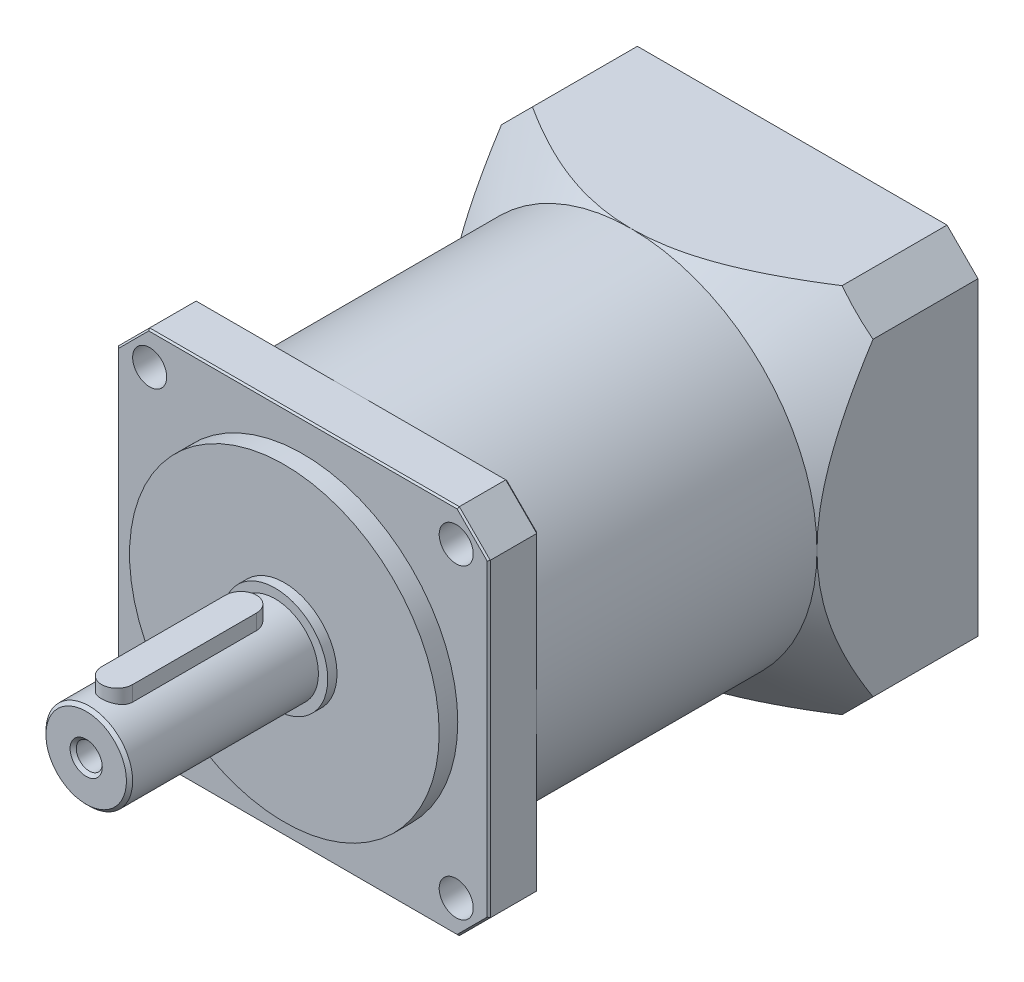
from build123d import *
from build123d.topology import SkipClean

# Parameters (mm, degrees)
SKETCH_1_W                  = 60
SKETCH_1_H                  = 60
EXTRUDE_1_DEPTH             = 32
SKETCH_2_R                  = 30
EXTRUDE_2_DEPTH             = 39
SKETCH_3_W                  = 60
SKETCH_3_H                  = 60
EXTRUDE_3_DEPTH             = 8
SKETCH_4_R                  = 25
EXTRUDE_4_DEPTH             = 3
SKETCH_5_R                  = 7
EXTRUDE_5_DEPTH             = 35
SKETCH_6_R                  = 8.5
EXTRUDE_6_DEPTH             = 4.5
CHAMFER_1_SIZE              = 5
HOLE_WIZARD_5_5_5_5_1_D     = 5.5
HOLE_WIZARD_5_5_5_5_1_DEPTH = 24
HOLE_WIZARD_5_5_5_5_1_TIP   = 1.652366702
HOLE_WIZARD_M51_D           = 4.2
HOLE_WIZARD_M51_DEPTH       = 15
HOLE_WIZARD_M51_TIP         = 1.2618073
EXTRUDE_7_DEPTH             = 9
CHAMFER_2_SIZE              = 0.5
HOLE_WIZARD_M52_D           = 4.2
HOLE_WIZARD_M52_DEPTH       = 15
HOLE_WIZARD_M52_TIP         = 1.2618073
CHAMFER_3_SIZE              = 0.5
CHAMFER_4_SIZE              = 0.25


with BuildPart() as part:
    # Эскиз1 → Бобышка-Вытянуть1 (new body)
    with BuildSketch(Plane.XY):
        Rectangle(SKETCH_1_W, SKETCH_1_H)
    extrude(amount=EXTRUDE_1_DEPTH)

    # Эскиз2 → Бобышка-Вытянуть2 (add)
    with BuildSketch(Plane.XY.offset(32)):
        Circle(SKETCH_2_R)
    extrude(amount=EXTRUDE_2_DEPTH)

    # Эскиз3 → Бобышка-Вытянуть3 (add)
    with BuildSketch(Plane.XY.offset(71)):
        Rectangle(SKETCH_3_W, SKETCH_3_H)
    extrude(amount=EXTRUDE_3_DEPTH)

    # Эскиз4 → Бобышка-Вытянуть4 (add)
    with BuildSketch(Plane.XY.offset(79)):
        Circle(SKETCH_4_R)
    extrude(amount=EXTRUDE_4_DEPTH)

    # Эскиз5 → Бобышка-Вытянуть5 (add)
    with BuildSketch(Plane.XY.offset(79)):
        Circle(SKETCH_5_R)
    extrude(amount=EXTRUDE_5_DEPTH)

    # Эскиз6 → Бобышка-Вытянуть6 (add)
    with BuildSketch(Plane.XY.offset(79)):
        Circle(SKETCH_6_R)
    extrude(amount=EXTRUDE_6_DEPTH)

    # Фаска1
    chamfer_1_edges = [part.edges().sort_by_distance(p)[0] for p in [
        (-30, 30, 75),
        (-30, -30, 75),
        (30, -30, 75),
        (30, 30, 75),
        (30, -30, 16),
        (-30, -30, 16),
        (-30, 30, 16),
        (30, 30, 16),
    ]]
    chamfer(chamfer_1_edges, length=CHAMFER_1_SIZE)

    # Диаметр отверстия Ø5.5 (5.5)1
    with Locations(Plane.XY.offset(79)):
        with Locations((-24.748737342, 24.748737342), (24.748737342, 24.748737342), (24.748737342, -24.748737342), (-24.748737342, -24.748737342)):
            Hole(HOLE_WIZARD_5_5_5_5_1_D / 2, depth=HOLE_WIZARD_5_5_5_5_1_DEPTH)
            with Locations((0, 0, -(HOLE_WIZARD_5_5_5_5_1_DEPTH + HOLE_WIZARD_5_5_5_5_1_TIP / 2))):  # 118° drill point
                Cone(0, HOLE_WIZARD_5_5_5_5_1_D / 2, HOLE_WIZARD_5_5_5_5_1_TIP, mode=Mode.SUBTRACT)

    # Отверстие обработанное метчиком M51
    with Locations(Plane(origin=(0, 0, 0), x_dir=(-1, 0, 0), z_dir=(0, 0, -1))):
        with Locations((-23.57, 23.57), (23.57, 23.57), (23.57, -23.57), (-23.57, -23.57)):
            Hole(HOLE_WIZARD_M51_D / 2, depth=HOLE_WIZARD_M51_DEPTH)
            with Locations((0, 0, -(HOLE_WIZARD_M51_DEPTH + HOLE_WIZARD_M51_TIP / 2))):  # 118° drill point
                Cone(0, HOLE_WIZARD_M51_D / 2, HOLE_WIZARD_M51_TIP, mode=Mode.SUBTRACT)

    # Эскиз13 → Вырез-Повернуть1 (revolve, cut)
    with SkipClean():  # the faces are left unmerged after this step: merging them gives an invalid solid
        with BuildSketch(Plane(origin=(0, 0, 0), x_dir=(0, 0, -1), z_dir=(1, 0, 0)), mode=Mode.PRIVATE) as cut_revolve_1_sk:
            Polygon((-32, 41), (-15, 41), (-26, 30), (-32, 30), align=None)
        revolve(cut_revolve_1_sk.sketch.rotate(Axis((0, 0, 0), (0, 0, 1)), 90), axis=Axis((0, 0, 0), (0, 0, 1)), mode=Mode.SUBTRACT)

    # Эскиз14 → Бобышка-Вытянуть7 (add)
    with SkipClean():  # the faces are left unmerged after this step: merging them gives an invalid solid
        with BuildSketch(Plane(origin=(0, 0, 0), x_dir=(1, 0, 0), z_dir=(0, 1, 0))):
            with BuildLine():
                Line((2.5, -89), (2.5, -109))
                ThreePointArc((2.5, -109), (0, -111.5), (-2.5, -109))
                Line((-2.5, -109), (-2.5, -89))
                ThreePointArc((-2.5, -89), (0, -86.5), (2.5, -89))
            make_face()
        extrude(amount=EXTRUDE_7_DEPTH)

    # Фаска2
    chamfer_2_edges = [part.edges().sort_by_distance(p)[0] for p in [
        (-7, 0, 114),
    ]]
    chamfer(chamfer_2_edges, length=CHAMFER_2_SIZE)

    # Отверстие обработанное метчиком M52
    with Locations(Plane.XY.offset(114)):
        with Locations((0, 0)):
            Hole(HOLE_WIZARD_M52_D / 2, depth=HOLE_WIZARD_M52_DEPTH)
            with Locations((0, 0, -(HOLE_WIZARD_M52_DEPTH + HOLE_WIZARD_M52_TIP / 2))):  # 118° drill point
                Cone(0, HOLE_WIZARD_M52_D / 2, HOLE_WIZARD_M52_TIP, mode=Mode.SUBTRACT)

    # Фаска3
    chamfer_3_edges = [part.edges().sort_by_distance(p)[0] for p in [
        (2.1, 0, 114),
    ]]
    chamfer(chamfer_3_edges, length=CHAMFER_3_SIZE)

    # Фаска4
    # the kernel refuses this chamfer: 0.25 mm, written as the material it takes off along each edge
    with BuildSketch(Plane(origin=(-30, -25.642920747, 71), x_dir=(-0.02749587661058229, 0, 0.9996219169112968), z_dir=(0, 1, 0))) as chamfer_4_piece_1_section:
        Polygon((CHAMFER_4_SIZE * 0.999621916911, CHAMFER_4_SIZE * 0.0274958766106), (-CHAMFER_4_SIZE * 0.0274958766106, CHAMFER_4_SIZE * 0.999621916911), (0, 0), align=None)
    chamfer_4_piece_1 = extrude(amount=25.642920747, mode=Mode.PRIVATE)
    chamfer_4_piece_1 = chamfer_4_piece_1 - Plane(origin=(0, 0, 71.084323924), x_dir=(1, 0, 0), z_dir=(0, 0, -1)) * Cylinder(30, 53, mode=Mode.PRIVATE)
    add(chamfer_4_piece_1, mode=Mode.SUBTRACT)
    with BuildSketch(Plane(origin=(25.642920747, -30, 71), x_dir=(0, -0.02749587661058229, 0.9996219169112968), z_dir=(-1, 0, 0))) as chamfer_4_piece_2_section:
        Polygon((CHAMFER_4_SIZE * 0.999621916911, CHAMFER_4_SIZE * 0.0274958766106), (-CHAMFER_4_SIZE * 0.0274958766106, CHAMFER_4_SIZE * 0.999621916911), (0, 0), align=None)
    chamfer_4_piece_2 = extrude(amount=25.642920747, mode=Mode.PRIVATE)
    chamfer_4_piece_2 = chamfer_4_piece_2 - Plane(origin=(0, 0, 71.084323924), x_dir=(1, 0, 0), z_dir=(0, 0, -1)) * Cylinder(30, 53, mode=Mode.PRIVATE)
    add(chamfer_4_piece_2, mode=Mode.SUBTRACT)
    with BuildSketch(Plane(origin=(30, 25.642920747, 71), x_dir=(0.02749587661058229, 0, 0.9996219169112968), z_dir=(0, -1, 0))) as chamfer_4_piece_3_section:
        Polygon((CHAMFER_4_SIZE * 0.999621916911, CHAMFER_4_SIZE * 0.0274958766106), (-CHAMFER_4_SIZE * 0.0274958766106, CHAMFER_4_SIZE * 0.999621916911), (0, 0), align=None)
    chamfer_4_piece_3 = extrude(amount=25.642920747, mode=Mode.PRIVATE)
    chamfer_4_piece_3 = chamfer_4_piece_3 - Plane(origin=(0, 0, 71.084323924), x_dir=(1, 0, 0), z_dir=(0, 0, -1)) * Cylinder(30, 53, mode=Mode.PRIVATE)
    add(chamfer_4_piece_3, mode=Mode.SUBTRACT)
    with BuildSketch(Plane(origin=(-25.642920747, 30, 71), x_dir=(0, 0.02749587661058229, 0.9996219169112968), z_dir=(1, 0, 0))) as chamfer_4_piece_4_section:
        Polygon((CHAMFER_4_SIZE * 0.999621916911, CHAMFER_4_SIZE * 0.0274958766106), (-CHAMFER_4_SIZE * 0.0274958766106, CHAMFER_4_SIZE * 0.999621916911), (0, 0), align=None)
    chamfer_4_piece_4 = extrude(amount=25.642920754, mode=Mode.PRIVATE)
    chamfer_4_piece_4 = chamfer_4_piece_4 - Plane(origin=(0, 0, 71.084323924), x_dir=(1, 0, 0), z_dir=(0, 0, -1)) * Cylinder(30, 53, mode=Mode.PRIVATE)
    add(chamfer_4_piece_4, mode=Mode.SUBTRACT)
    with BuildSketch(Plane(origin=(7e-09, 30, 71), x_dir=(0, 0.02749587661058229, 0.9996219169112968), z_dir=(1, 0, 0))) as chamfer_4_piece_5_section:
        Polygon((CHAMFER_4_SIZE * 0.999621916911, CHAMFER_4_SIZE * 0.0274958766106), (-CHAMFER_4_SIZE * 0.0274958766106, CHAMFER_4_SIZE * 0.999621916911), (0, 0), align=None)
    chamfer_4_piece_5 = extrude(amount=25.64292074, mode=Mode.PRIVATE)
    chamfer_4_piece_5 = chamfer_4_piece_5 - Plane(origin=(0, 0, 71.084323925), x_dir=(1, 0, 0), z_dir=(0, 0, -1)) * Cylinder(30, 53, mode=Mode.PRIVATE)
    add(chamfer_4_piece_5, mode=Mode.SUBTRACT)
    with BuildSketch(Plane(origin=(-25.642920747, 30, 79), x_dir=(0, -0.999621916911297, 0.027495876610582292), z_dir=(1, 0, 0)), Plane(origin=(30, 25.642920747, 79), x_dir=(-0.999621916911297, 0, 0.027495876610582292), z_dir=(0, -1, 0)), Plane(origin=(-30, -25.642920747, 79), x_dir=(0.999621916911297, 0, 0.027495876610582292), z_dir=(0, 1, 0)), Plane(origin=(25.642920747, -30, 79), x_dir=(0, 0.999621916911297, 0.027495876610582292), z_dir=(-1, 0, 0))) as chamfer_4_piece_6:
        Polygon((CHAMFER_4_SIZE * 0.999621916911, CHAMFER_4_SIZE * 0.0274958766106), (-CHAMFER_4_SIZE * 0.0274958766106, CHAMFER_4_SIZE * 0.999621916911), (0, 0), align=None)
    extrude(amount=51.285841494, mode=Mode.SUBTRACT)
    with BuildSketch(Plane(origin=(30.45461362, 24.54538638, 71), x_dir=(0.019442520806003522, 0.019442520806003522, 0.9996219169112972), z_dir=(-0.7071067811865476, 0.7071067811865476, 0)), Plane(origin=(30.45461362, 24.54538638, 79), x_dir=(-0.7068394360706736, -0.7068394360706736, 0.027495876610582108), z_dir=(-0.7071067811865476, 0.7071067811865476, 0))) as chamfer_4_piece_7:
        Polygon((CHAMFER_4_SIZE * 0.999621916911, -CHAMFER_4_SIZE * 0.0274958766106), (-CHAMFER_4_SIZE * 0.0274958766106, -CHAMFER_4_SIZE * 0.999621916911), (0, 0), align=None)
    extrude(amount=8.356909306, mode=Mode.SUBTRACT)
    with BuildSketch(Plane(origin=(30, 0, 71), x_dir=(0.02749587661058229, 0, 0.9996219169112968), z_dir=(0, -1, 0))) as chamfer_4_piece_8_section:
        Polygon((CHAMFER_4_SIZE * 0.999621916911, CHAMFER_4_SIZE * 0.0274958766106), (-CHAMFER_4_SIZE * 0.0274958766106, CHAMFER_4_SIZE * 0.999621916911), (0, 0), align=None)
    chamfer_4_piece_8 = extrude(amount=25.642920747, mode=Mode.PRIVATE)
    chamfer_4_piece_8 = chamfer_4_piece_8 - Plane(origin=(0, 0, 71.084323924), x_dir=(1, 0, 0), z_dir=(0, 0, -1)) * Cylinder(30, 53, mode=Mode.PRIVATE)
    add(chamfer_4_piece_8, mode=Mode.SUBTRACT)
    with BuildSketch(Plane(origin=(-30.45461362, 24.54538638, 79), x_dir=(0.7068394360706736, -0.7068394360706736, 0.027495876610582108), z_dir=(0.7071067811865476, 0.7071067811865476, 0)), Plane(origin=(-24.54538638, -30.45461362, 79), x_dir=(0.7068394360706736, 0.7068394360706736, 0.027495876610582108), z_dir=(-0.7071067811865476, 0.7071067811865476, 0)), Plane(origin=(30.45461362, -24.54538638, 79), x_dir=(-0.7068394360706736, 0.7068394360706736, 0.027495876610582108), z_dir=(-0.7071067811865476, -0.7071067811865476, 0)), Plane(origin=(30.45461362, -24.54538638, 71), x_dir=(0.019442520806003522, -0.019442520806003522, 0.9996219169112972), z_dir=(-0.7071067811865476, -0.7071067811865476, 0)), Plane(origin=(-24.54538638, -30.45461362, 71), x_dir=(-0.019442520806010426, -0.019442520806010426, 0.999621916911297), z_dir=(-0.7071067811865476, 0.7071067811865476, 0)), Plane(origin=(-30.45461362, 24.54538638, 71), x_dir=(-0.019442520806003522, 0.019442520806003522, 0.9996219169112972), z_dir=(0.7071067811865476, 0.7071067811865476, 0))) as chamfer_4_piece_9:
        Polygon((CHAMFER_4_SIZE * 0.999621916911, CHAMFER_4_SIZE * 0.0274958766106), (-CHAMFER_4_SIZE * 0.0274958766106, CHAMFER_4_SIZE * 0.999621916911), (0, 0), align=None)
    extrude(amount=8.356909306, mode=Mode.SUBTRACT)
    with BuildSketch(Plane(origin=(0, -30, 71), x_dir=(0, -0.02749587661058229, 0.9996219169112968), z_dir=(-1, 0, 0))) as chamfer_4_piece_10_section:
        Polygon((CHAMFER_4_SIZE * 0.999621916911, CHAMFER_4_SIZE * 0.0274958766106), (-CHAMFER_4_SIZE * 0.0274958766106, CHAMFER_4_SIZE * 0.999621916911), (0, 0), align=None)
    chamfer_4_piece_10 = extrude(amount=25.642920747, mode=Mode.PRIVATE)
    chamfer_4_piece_10 = chamfer_4_piece_10 - Plane(origin=(0, 0, 71.084323925), x_dir=(1, 0, 0), z_dir=(0, 0, -1)) * Cylinder(30, 53, mode=Mode.PRIVATE)
    add(chamfer_4_piece_10, mode=Mode.SUBTRACT)
    with BuildSketch(Plane(origin=(-30, 0, 71), x_dir=(-0.02749587661058229, 0, 0.9996219169112968), z_dir=(0, 1, 0))) as chamfer_4_piece_11_section:
        Polygon((CHAMFER_4_SIZE * 0.999621916911, CHAMFER_4_SIZE * 0.0274958766106), (-CHAMFER_4_SIZE * 0.0274958766106, CHAMFER_4_SIZE * 0.999621916911), (0, 0), align=None)
    chamfer_4_piece_11 = extrude(amount=25.642920747, mode=Mode.PRIVATE)
    chamfer_4_piece_11 = chamfer_4_piece_11 - Plane(origin=(0, 0, 71.084323925), x_dir=(1, 0, 0), z_dir=(0, 0, -1)) * Cylinder(30, 53, mode=Mode.PRIVATE)
    add(chamfer_4_piece_11, mode=Mode.SUBTRACT)


solid = part.part
